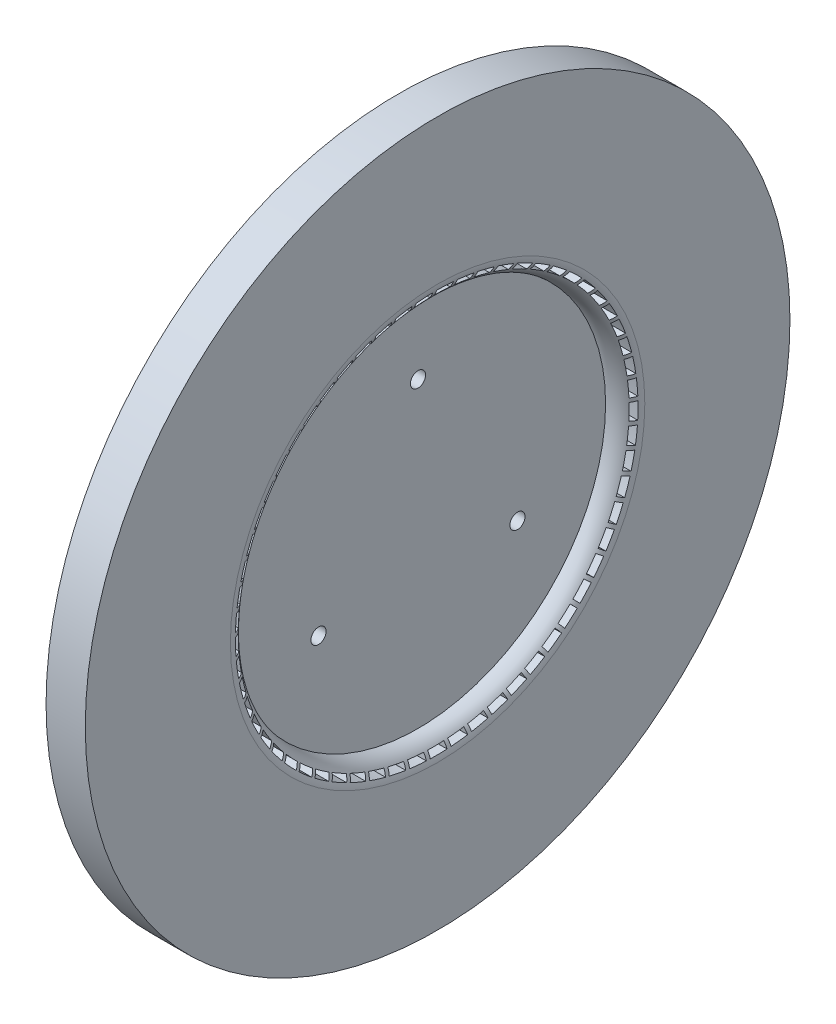
from build123d import *

# Parameters (mm, degrees)
SKETCH1_R                             = 89.825
SKETCH1_R_2                           = 47.825
FLANGE_DEPTH                          = 10
REGEN_SLOTS_DEPTH                     = 25
SKETCH3_R                             = 47.825
FACEPLATE_EXTRUSION_TO_MANIFOLD_DEPTH = 5
FACEPLATE_START                       = 5
SKETCH4_R                             = 47.825
FACEPLATE_EXTRUSION_TO_CHAMBER_DEPTH  = 5
REGEN_FILLET_R                        = 5
SKETCH5_R                             = 47.825
SKETCH5_R_2                           = 44.825
O_RING_SLOT_DEPTH                     = 6.5
SKETCH6_R                             = 1.931885
FUEL_ORIFICES_DEPTH                   = 128.914273062


with BuildPart() as part:
    # Sketch1 → Flange (new body)
    with BuildSketch(Plane(origin=(0, 0, 0), x_dir=(0, 0, -1), z_dir=(1, 0, 0))):
        Circle(SKETCH1_R)
        Circle(SKETCH1_R_2, mode=Mode.SUBTRACT)
    extrude(amount=FLANGE_DEPTH)

    # Sketch2 → Regen Slots (cut)
    with BuildSketch(Plane(origin=(10, 0, 0), x_dir=(0, 0, -1), z_dir=(1, 0, 0))):
        with BuildLine():
            ThreePointArc((-19.952615849, 45.655489766), (-18.042869594, 46.443357779), (-16.102104764, 47.15138224))
            Line((-16.102104764, 47.15138224), (-16.55836623, 48.580614784))
            ThreePointArc((-16.55836623, 48.580614784), (-18.57202224, 47.847002152), (-20.553296708, 47.029965123))
            Line((-20.553296708, 47.029965123), (-19.952615849, 45.655489766))
        make_face()
        with BuildLine():
            ThreePointArc((-15.152521521, 47.465057849), (-13.171887784, 48.052388049), (-11.168609468, 48.557108517))
            Line((-11.168609468, 48.557108517), (-11.475497576, 50.02567921))
            ThreePointArc((-11.475497576, 50.02567921), (-13.553911741, 49.503000934), (-15.608693769, 48.89401092))
            Line((-15.608693769, 48.89401092), (-15.152521521, 47.465057849))
        make_face()
        with BuildLine():
            ThreePointArc((-10.191806695, 48.77148451), (-8.161280686, 49.152051051), (-6.116724133, 49.448117364))
            Line((-6.116724133, 49.448117364), (-6.270985793, 50.940458991))
            ThreePointArc((-6.270985793, 50.940458991), (-8.392126406, 50.634255592), (-10.498634794, 50.239768038))
            Line((-10.498634794, 50.239768038), (-10.191806695, 48.77148451))
        make_face()
        with BuildLine():
            ThreePointArc((-5.123056182, 49.560921302), (-3.064161983, 49.730690085), (-1, 49.814963866))
            Line((-1, 49.814963866), (-1, 51.315257234))
            ThreePointArc((-1, 51.315257234), (-3.141382443, 51.228774545), (-5.277287678, 51.052971116))
            Line((-5.277287678, 51.052971116), (-5.123056182, 49.560921302))
        make_face()
        with BuildLine():
            Line((0, 51.325), (0, 49.825))
            ThreePointArc((0, 49.825), (2.065437599, 49.782171432), (4.127324381, 49.653759359))
            Line((4.127324381, 49.653759359), (4.281586042, 51.146100985))
            ThreePointArc((4.281586042, 51.146100985), (2.142660956, 51.280255743), (0, 51.325))
        make_face()
        with BuildLine():
            Line((5.277287678, 51.052971116), (5.123056182, 49.560921302))
            ThreePointArc((5.123056182, 49.560921302), (7.17314303, 49.305949378), (9.210898098, 48.966212649))
            Line((9.210898098, 48.966212649), (9.517786206, 50.434783342))
            ThreePointArc((9.517786206, 50.434783342), (7.403991615, 50.788153473), (5.277287678, 51.052971116))
        make_face()
        with BuildLine():
            Line((10.498634794, 50.239768038), (10.191806695, 48.77148451))
            ThreePointArc((10.191806695, 48.77148451), (12.204811359, 48.307071995), (14.196834003, 47.759611905))
            Line((14.196834003, 47.759611905), (14.653095469, 49.188844449))
            ThreePointArc((14.653095469, 49.188844449), (12.586838122, 49.757684141), (10.498634794, 50.239768038))
        make_face()
        with BuildLine():
            Line((15.608693769, 48.89401092), (15.152521521, 47.465057849))
            ThreePointArc((15.152521521, 47.465057849), (17.107105652, 46.79612763), (19.032279936, 46.046747393))
            Line((19.032279936, 46.046747393), (19.633078274, 47.421491567))
            ThreePointArc((19.633078274, 47.421491567), (17.636261013, 48.19977098), (15.608693769, 48.89401092))
        make_face()
        with BuildLine():
            Line((20.553296708, 47.029965123), (19.952615849, 45.655489766))
            ThreePointArc((19.952615849, 45.655489766), (21.828060369, 44.789132672), (23.665978967, 43.845775903))
            Line((23.665978967, 43.845775903), (24.404945566, 45.151459078))
            ThreePointArc((24.404945566, 45.151459078), (22.498735149, 46.130928255), (20.553296708, 47.029965123))
        make_face()
        with BuildLine():
            Line((25.280029588, 44.667389996), (24.541207486, 43.361962134))
            ThreePointArc((24.541207486, 43.361962134), (26.317632217, 42.307361765), (28.048812733, 41.180028282))
            Line((28.048812733, 41.180028282), (28.918114364, 42.402809891))
            ThreePointArc((28.918114364, 42.402809891), (27.122717097, 43.573086215), (25.280029588, 44.667389996))
        make_face()
        with BuildLine():
            Line((29.738787865, 41.831329423), (28.869656218, 40.608786917))
            ThreePointArc((28.869656218, 40.608786917), (30.528230615, 39.377122298), (32.134322107, 38.077762116))
            Line((32.134322107, 38.077762116), (33.124743955, 39.20468037))
            ThreePointArc((33.124743955, 39.20468037), (31.459191495, 40.553358621), (29.738787865, 41.831329423))
        make_face()
        with BuildLine():
            Line((33.882307593, 38.551846352), (32.892079412, 37.425148456))
            ThreePointArc((32.892079412, 37.425148456), (34.415222175, 36.02947554), (35.879199672, 34.571862199))
            Line((35.879199672, 34.571862199), (36.98024302, 35.590971484))
            ThreePointArc((36.98024302, 35.590971484), (35.462190638, 37.103755338), (33.882307593, 38.551846352))
        make_face()
        with BuildLine():
            Line((37.666666432, 34.863704119), (36.565838382, 33.844794111))
            ThreePointArc((36.565838382, 33.844794111), (37.937403818, 32.299907377), (39.243748795, 30.699491942))
            Line((39.243748795, 30.699491942), (40.443742309, 31.599989447))
            ThreePointArc((40.443742309, 31.599989447), (39.089281738, 33.260843017), (37.666666432, 34.863704119))
        make_face()
        with BuildLine():
            Line((41.051749236, 30.805997949), (39.851990369, 29.905676528))
            ThreePointArc((39.851990369, 29.905676528), (41.057439543, 28.227952161), (42.192304418, 26.501699434))
            Line((42.192304418, 26.501699434), (43.478527869, 27.27403966))
            ThreePointArc((43.478527869, 27.27403966), (42.302016727, 29.065357486), (41.051749236, 30.805997949))
        make_face()
        with BuildLine():
            Line((44.001673286, 26.421740537), (42.715701344, 25.649551335))
            ThreePointArc((42.715701344, 25.649551335), (43.742256194, 23.85677363), (44.693611118, 22.022982319))
            Line((44.693611118, 22.022982319), (46.052430217, 22.658978268))
            ThreePointArc((46.052430217, 22.658978268), (45.066339816, 24.561771935), (44.001673286, 26.421740537))
        make_face()
        with BuildLine():
            Line((46.485168653, 21.757406103), (45.126615258, 21.121534517))
            ThreePointArc((45.126615258, 21.121534517), (45.963394049, 19.232707363), (46.721154422, 17.310816112))
            Line((46.721154422, 17.310816112), (48.138165348, 17.803726069))
            ThreePointArc((48.138165348, 17.803726069), (47.352948491, 19.797825492), (46.485168653, 21.757406103))
        make_face()
        with BuildLine():
            Line((48.475909667, 16.862437752), (47.059175824, 16.369624179))
            ThreePointArc((47.059175824, 16.369624179), (47.697308492, 14.404769614), (48.253441866, 12.415150949))
            Line((48.253441866, 12.415150949), (49.713623951, 12.759749945))
            ThreePointArc((49.713623951, 12.759749945), (49.137604132, 14.824017173), (48.475909667, 16.862437752))
        make_face()
        with BuildLine():
            Line((49.95279398, 11.788723365), (48.49289742, 11.444191752))
            ThreePointArc((48.49289742, 11.444191752), (48.925619599, 9.424137723), (49.274230822, 7.387882096))
            Line((49.274230822, 7.387882096), (50.762105773, 7.580517297))
            ThreePointArc((50.762105773, 7.580517297), (50.401388946, 9.693070584), (49.95279398, 11.788723365))
        make_face()
        with BuildLine():
            Line((50.90016625, 6.590045578), (49.412582239, 6.397448045))
            ThreePointArc((49.412582239, 6.397448045), (49.635306968, 4.343607628), (49.772700674, 2.282299856))
            Line((49.772700674, 2.282299856), (51.272496646, 2.32092928))
            ThreePointArc((51.272496646, 2.32092928), (51.130906498, 4.459375036), (50.90016625, 6.590045578))
        make_face()
        with BuildLine():
            Line((51.307984095, 1.321511668), (49.808481394, 1.282889798))
            ThreePointArc((49.808481394, 1.282889798), (49.820870177, 0.64149807), (49.825, 0))
            ThreePointArc((49.825, 0), (49.804637718, -1.424319751), (49.743567516, -2.847475331))
            Line((49.743567516, -2.847475331), (51.239386299, -2.963261165))
            ThreePointArc((51.239386299, -2.963261165), (51.30359211, -1.482248835), (51.325, 0))
            ThreePointArc((51.325, 0), (51.320745847, 0.660810606), (51.307984095, 1.321511668))
        make_face()
        with BuildLine():
            Line((51.171924545, -3.961030594), (49.676398255, -3.8452674))
            ThreePointArc((49.676398255, -3.8452674), (49.474296322, -5.901239572), (49.187140168, -7.947066571))
            Line((49.187140168, -7.947066571), (50.66312571, -8.216040304))
            ThreePointArc((50.66312571, -8.216040304), (50.961952887, -6.093847961), (51.171924545, -3.961030594))
        make_face()
        with BuildLine():
            Line((50.493429865, -9.201584946), (49.017732937, -8.932663808))
            ThreePointArc((49.017732937, -8.932663808), (48.60530506, -10.956958749), (48.109316898, -12.962416928))
            Line((48.109316898, -12.962416928), (49.549823386, -13.381727372))
            ThreePointArc((49.549823386, -13.381727372), (50.065272674, -11.301508621), (50.493429865, -9.201584946))
        make_face()
        with BuildLine():
            Line((49.279692266, -14.344600209), (47.839467456, -13.925371756))
            ThreePointArc((47.839467456, -13.925371756), (47.221085473, -15.896531437), (46.521522901, -17.840362441))
            Line((46.521522901, -17.840362441), (47.911280607, -18.405564801))
            ThreePointArc((47.911280607, -18.405564801), (48.637888116, -16.389370478), (49.279692266, -14.344600209))
        make_face()
        with BuildLine():
            Line((47.543577671, -19.335559141), (46.154091718, -18.7704673))
            ThreePointArc((46.154091718, -18.7704673), (45.336310633, -20.667596938), (44.440589187, -22.529195674))
            Line((44.440589187, -22.529195674), (45.764866334, -23.234298664))
            ThreePointArc((45.764866334, -23.234298664), (46.694929844, -21.30350093), (47.543577671, -19.335559141))
        make_face()
        with BuildLine():
            Line((45.303489324, -24.121556336), (43.979471127, -23.416591221))
            ThreePointArc((43.979471127, -23.416591221), (42.970959622, -25.219580769), (41.888574173, -26.979213828))
            Line((41.888574173, -26.979213828), (43.133333094, -27.816743182))
            ThreePointArc((43.133333094, -27.816743182), (44.256993699, -25.991808973), (45.303489324, -24.121556336))
        make_face()
        with BuildLine():
            Line((42.583172721, -28.651859033), (41.3386572, -27.81449345))
            ThreePointArc((41.3386572, -27.81449345), (40.150105749, -29.50423077), (38.892529852, -31.143245604))
            Line((38.892529852, -31.143245604), (40.044575792, -32.104323301))
            ThreePointArc((40.044575792, -32.104323301), (41.349922412, -30.404597375), (42.583172721, -28.651859033))
        make_face()
        with BuildLine():
            Line((39.411463893, -32.878444897), (38.259643224, -31.917555129))
            ThreePointArc((38.259643224, -31.917555129), (36.903650767, -33.476128585), (35.484215039, -34.977151229))
            Line((35.484215039, -34.977151229), (36.531336025, -36.051589607))
            ThreePointArc((36.531336025, -36.051589607), (38.00453166, -34.495089481), (39.411463893, -32.878444897))
        make_face()
        with BuildLine():
            Line((35.821983743, -36.756511065), (34.775067511, -35.682282783))
            ThreePointArc((34.775067511, -35.682282783), (33.266007906, -37.09317111), (31.699758719, -38.44029035))
            Line((31.699758719, -38.44029035), (32.630855008, -39.616700095))
            ThreePointArc((32.630855008, -39.616700095), (34.256283418, -38.219925057), (35.821983743, -36.756511065))
        make_face()
        with BuildLine():
            Line((31.852781655, -40.244949073), (30.921867432, -39.068769363))
            ThreePointArc((30.921867432, -39.068769363), (29.275737086, -40.317016793), (27.579277071, -41.49595283))
            Line((27.579277071, -41.49595283), (28.384478811, -42.761863706))
            ThreePointArc((28.384478811, -42.761863706), (30.14491005, -41.53961992), (31.852781655, -40.244949073))
        make_face()
        with BuildLine():
            Line((27.545932157, -43.306780608), (26.740887866, -42.041117268))
            ThreePointArc((26.740887866, -42.041117268), (24.97513617, -43.113492068), (23.166448225, -44.111747887))
            Line((23.166448225, -44.111747887), (23.837220077, -45.453740924))
            ThreePointArc((23.837220077, -45.453740924), (25.713993136, -44.418984477), (27.545932157, -43.306780608))
        make_face()
        with BuildLine():
            Line((22.947088925, -45.909549495), (22.276448235, -44.567818872))
            ThreePointArc((22.276448235, -44.567818872), (20.409792597, -45.452953602), (18.508049264, -46.259947443))
            Line((18.508049264, -46.259947443), (19.03728088, -47.663797181))
            ThreePointArc((19.03728088, -47.663797181), (21.010501499, -46.827496749), (22.947088925, -45.909549495))
        make_face()
        with BuildLine():
            Line((18.105000842, -48.025665737), (17.575872712, -46.622090509))
            ThreePointArc((17.575872712, -46.622090509), (15.628100145, -47.31060252), (13.653460377, -47.917780048))
            Line((13.653460377, -47.917780048), (14.03554177, -49.36860533))
            ThreePointArc((14.03554177, -49.36860533), (16.084293318, -48.739625906), (18.105000842, -48.025665737))
        make_face()
        with BuildLine():
            Line((13.070995246, -49.632697975), (12.688988566, -48.182156388))
            ThreePointArc((12.688988566, -48.182156388), (10.680745944, -48.666747283), (8.654141414, -49.067672264))
            Line((8.654141414, -49.067672264), (8.885022426, -50.550093981))
            ThreePointArc((8.885022426, -50.550093981), (10.987587627, -50.135102903), (13.070995246, -49.632697975))
        make_face()
        with BuildLine():
            Line((7.898433849, -50.713611267), (7.667597984, -49.231479423))
            ThreePointArc((7.667597984, -49.231479423), (5.620173179, -49.507012417), (3.563086399, -49.697434947))
            Line((3.563086399, -49.697434947), (3.640319633, -51.195739061))
            ThreePointArc((3.640319633, -51.195739061), (5.774410774, -50.999135338), (7.898433849, -50.713611267))
        make_face()
        with BuildLine():
            Line((2.642147089, -51.256947663), (2.564928956, -49.758936529))
            ThreePointArc((2.564928956, -49.758936529), (0.50002518, -49.822490903), (-1.565738219, -49.800392457))
            Line((-1.565738219, -49.800392457), (-1.642971453, -51.29869657))
            ThreePointArc((-1.642971453, -51.29869657), (0.50002373, -51.322564251), (2.642147089, -51.256947663))
        make_face()
        with BuildLine():
            ThreePointArc((-2.564928956, -49.758936529), (-4.62542321, -49.609838592), (-6.677965622, -49.375453417))
            Line((-6.677965622, -49.375453417), (-6.908846633, -50.857875135))
            ThreePointArc((-6.908846633, -50.857875135), (-4.77966369, -51.101961215), (-2.642147089, -51.256947663))
            Line((-2.642147089, -51.256947663), (-2.564928956, -49.758936529))
        make_face()
        with BuildLine():
            ThreePointArc((-7.667597984, -49.231479423), (-9.701840963, -48.87130965), (-11.719404928, -48.427122288))
            Line((-11.719404928, -48.427122288), (-12.10148632, -49.87794757))
            ThreePointArc((-12.10148632, -49.87794757), (-10.008685486, -50.339664678), (-7.898433849, -50.713611267))
            Line((-7.898433849, -50.713611267), (-7.667597984, -49.231479423))
        make_face()
        with BuildLine():
            ThreePointArc((-12.688988566, -48.182156388), (-14.675416789, -47.614732668), (-16.636615626, -46.965451616))
            Line((-16.636615626, -46.965451616), (-17.165847242, -48.369301354))
            ThreePointArc((-17.165847242, -48.369301354), (-15.131612725, -49.043755172), (-13.070995246, -49.632697975))
            Line((-13.070995246, -49.632697975), (-12.688988566, -48.182156388))
        make_face()
        with BuildLine():
            ThreePointArc((-17.575872712, -46.622090509), (-19.493429546, -45.853427675), (-21.37747406, -45.005935473))
            Line((-21.37747406, -45.005935473), (-22.048245913, -46.34792851))
            ThreePointArc((-22.048245913, -46.34792851), (-20.094141106, -47.22796966), (-18.105000842, -48.025665737))
            Line((-18.105000842, -48.025665737), (-17.575872712, -46.622090509))
        make_face()
        with BuildLine():
            ThreePointArc((-22.276448235, -44.567818872), (-24.104807101, -43.606064941), (-25.891725951, -42.569345218))
            Line((-25.891725951, -42.569345218), (-26.696927691, -43.835256094))
            ThreePointArc((-26.696927691, -43.835256094), (-24.843666592, -44.911555921), (-22.947088925, -45.909549495))
            Line((-22.947088925, -45.909549495), (-22.276448235, -44.567818872))
        make_face()
        with BuildLine():
            ThreePointArc((-26.740887866, -42.041117268), (-28.460667703, -40.896467071), (-30.131519106, -39.681509313))
            Line((-30.131519106, -39.681509313), (-31.062615395, -40.857919059))
            ThreePointArc((-31.062615395, -40.857919059), (-29.329843032, -42.119068517), (-27.545932157, -43.306780608))
            Line((-27.545932157, -43.306780608), (-26.740887866, -42.041117268))
        make_face()
        with BuildLine():
            ThreePointArc((-30.921867432, -39.068769363), (-32.514838148, -37.753356476), (-34.051910662, -36.373039538))
            Line((-34.051910662, -36.373039538), (-35.099031649, -37.447477917))
            ThreePointArc((-35.099031649, -37.447477917), (-33.505115839, -38.880108508), (-31.852781655, -40.244949073))
            Line((-31.852781655, -40.244949073), (-30.921867432, -39.068769363))
        make_face()
        with BuildLine():
            ThreePointArc((-34.775067511, -35.682282783), (-36.224343219, -34.210050911), (-37.611343494, -32.679006496))
            Line((-37.611343494, -32.679006496), (-38.763389435, -33.640084193))
            ThreePointArc((-38.763389435, -33.640084193), (-37.325226083, -35.229009678), (-35.821983743, -36.756511065))
            Line((-35.821983743, -36.756511065), (-34.775067511, -35.682282783))
        make_face()
        with BuildLine():
            ThreePointArc((-38.259643224, -31.917555129), (-39.549861241, -30.304110295), (-40.772086729, -28.638567855))
            Line((-40.772086729, -28.638567855), (-42.01684565, -29.476097209))
            ThreePointArc((-42.01684565, -29.476097209), (-40.749679645, -31.20447458), (-39.411463893, -32.878444897))
            Line((-39.411463893, -32.878444897), (-38.259643224, -31.917555129))
        make_face()
        with BuildLine():
            ThreePointArc((-41.3386572, -27.81449345), (-42.456140895, -26.076938572), (-43.500635701, -24.29455327))
            Line((-43.500635701, -24.29455327), (-44.824912848, -24.999656261))
            ThreePointArc((-44.824912848, -24.999656261), (-43.742176466, -26.849164289), (-42.583172721, -28.651859033))
            Line((-42.583172721, -28.651859033), (-41.3386572, -27.81449345))
        make_face()
        with BuildLine():
            ThreePointArc((-43.979471127, -23.416591221), (-44.912374894, -21.573344812), (-45.768067113, -19.693010377))
            Line((-45.768067113, -19.693010377), (-47.157824819, -20.258212737))
            ThreePointArc((-47.157824819, -20.258212737), (-46.270995334, -22.209246178), (-45.303489324, -24.121556336))
            Line((-45.303489324, -24.121556336), (-43.979471127, -23.416591221))
        make_face()
        with BuildLine():
            ThreePointArc((-46.154091718, -18.7704673), (-46.892526546, -16.841068231), (-47.550345628, -14.882716675))
            Line((-47.550345628, -14.882716675), (-48.990852116, -15.302027119))
            ThreePointArc((-48.990852116, -15.302027119), (-48.309330141, -17.333904532), (-47.543577671, -19.335559141))
            Line((-47.543577671, -19.335559141), (-46.154091718, -18.7704673))
        make_face()
        with BuildLine():
            ThreePointArc((-47.839467456, -13.925371756), (-48.375605751, -11.930272137), (-48.828578651, -9.914662474))
            Line((-48.828578651, -9.914662474), (-50.304564193, -10.183636207))
            ThreePointArc((-50.304564193, -10.183636207), (-49.835574031, -12.274819185), (-49.279692266, -14.344600209))
            Line((-49.279692266, -14.344600209), (-47.839467456, -13.925371756))
        make_face()
        with BuildLine():
            ThreePointArc((-49.017732937, -8.932663808), (-49.3458915, -6.89301219), (-49.589216592, -4.841510384))
            Line((-49.589216592, -4.841510384), (-51.085035374, -4.957296218))
            ThreePointArc((-51.085035374, -4.957296218), (-50.833548438, -7.085617702), (-50.493429865, -9.201584946))
            Line((-50.493429865, -9.201584946), (-49.017732937, -8.932663808))
        make_face()
        with BuildLine():
            ThreePointArc((-49.676398255, -3.8452674), (-49.793098524, -1.7826846), (-49.824196501, 0.282962921))
            Line((-49.824196501, 0.282962921), (-51.323992473, 0.321592345))
            ThreePointArc((-51.323992473, 0.321592345), (-51.292674586, -1.821306909), (-51.171924545, -3.961030594))
            Line((-51.171924545, -3.961030594), (-49.676398255, -3.8452674))
        make_face()
        with BuildLine():
            ThreePointArc((-49.808481394, 1.282889798), (-49.712486316, 3.346539891), (-49.531027533, 5.404436748))
            Line((-49.531027533, 5.404436748), (-51.018902483, 5.597071949))
            ThreePointArc((-51.018902483, 5.597071949), (-51.208085623, 3.462310191), (-51.307984095, 1.321511668))
            Line((-51.307984095, 1.321511668), (-49.808481394, 1.282889798))
        make_face()
        with BuildLine():
            ThreePointArc((-49.412582239, 6.397448045), (-49.104909387, 8.440290227), (-48.71281735, 10.468622201))
            Line((-48.71281735, 10.468622201), (-50.172999435, 10.813221197))
            ThreePointArc((-50.172999435, 10.813221197), (-50.580678213, 8.709225942), (-50.90016625, 6.590045578))
            Line((-50.90016625, 6.590045578), (-49.412582239, 6.397448045))
        make_face()
        with BuildLine():
            ThreePointArc((-48.49289742, 11.444191752), (-47.976808202, 13.444571386), (-47.378239186, 15.421837655))
            Line((-47.378239186, 15.421837655), (-48.795250112, 15.914747611))
            ThreePointArc((-48.795250112, 15.914747611), (-49.417103031, 13.863821731), (-49.95279398, 11.788723365))
            Line((-49.95279398, 11.788723365), (-48.49289742, 11.444191752))
        make_face()
        with BuildLine():
            ThreePointArc((-47.059175824, 16.369624179), (-46.340140915, 18.306336744), (-45.5414399, 20.211577793))
            Line((-45.5414399, 20.211577793), (-46.900258998, 20.847573741))
            ThreePointArc((-46.900258998, 20.847573741), (-47.729694264, 18.871457561), (-48.475909667, 16.862437752))
            Line((-48.475909667, 16.862437752), (-47.059175824, 16.369624179))
        make_face()
        with BuildLine():
            ThreePointArc((-45.126615258, 21.121534517), (-44.212256606, 22.974050379), (-43.221890021, 24.787070178))
            Line((-43.221890021, 24.787070178), (-44.508113472, 25.559410404))
            ThreePointArc((-44.508113472, 25.559410404), (-45.536338864, 23.679051245), (-46.485168653, 21.757406103))
            Line((-46.485168653, 21.757406103), (-45.126615258, 21.121534517))
        make_face()
        with BuildLine():
            ThreePointArc((-39.851990369, 29.905676528), (-38.578029257, 31.53198826), (-37.23774635, 33.104091466))
            Line((-37.23774635, 33.104091466), (-38.338789698, 34.123200751))
            ThreePointArc((-38.338789698, 34.123200751), (-39.729905319, 32.492926128), (-41.051749236, 30.805997949))
            Line((-41.051749236, 30.805997949), (-39.851990369, 29.905676528))
        make_face()
        with BuildLine():
            ThreePointArc((-36.565838382, 33.844794111), (-35.131410429, 35.331496236), (-33.636585968, 36.757457874))
            Line((-33.636585968, 36.757457874), (-34.627007817, 37.884376129))
            ThreePointArc((-34.627007817, 37.884376129), (-36.178376815, 36.405778059), (-37.666666432, 34.863704119))
            Line((-37.666666432, 34.863704119), (-36.565838382, 33.844794111))
        make_face()
        with BuildLine():
            ThreePointArc((-32.892079412, 37.425148456), (-31.312389911, 38.756481562), (-29.678869408, 40.021186085))
            Line((-29.678869408, 40.021186085), (-30.548171039, 41.243967695))
            ThreePointArc((-30.548171039, 41.243967695), (-32.243348516, 39.932719685), (-33.882307593, 38.551846352))
            Line((-33.882307593, 38.551846352), (-32.892079412, 37.425148456))
        make_face()
        with BuildLine():
            ThreePointArc((-28.869656218, 40.608786917), (-27.16145027, 41.770638543), (-25.406549449, 42.860679767))
            Line((-25.406549449, 42.860679767), (-26.145516048, 44.166362943))
            ThreePointArc((-26.145516048, 44.166362943), (-27.966532702, 43.03636455), (-29.738787865, 41.831329423))
            Line((-29.738787865, 41.831329423), (-28.869656218, 40.608786917))
        make_face()
        with BuildLine():
            ThreePointArc((-24.541207486, 43.361962134), (-22.722592499, 44.342016363), (-20.864913745, 45.245839581))
            Line((-20.864913745, 45.245839581), (-21.465712083, 46.620583756))
            ThreePointArc((-21.465712083, 46.620583756), (-23.393264684, 45.683813243), (-25.280029588, 44.667389996))
            Line((-25.280029588, 44.667389996), (-24.541207486, 43.361962134))
        make_face()
        with BuildLine():
            ThreePointArc((-42.715701344, 25.649551335), (-41.615711378, 27.398233364), (-40.444177356, 29.099813453))
            Line((-40.444177356, 29.099813453), (-41.64417087, 30.000310957))
            ThreePointArc((-41.64417087, 30.000310957), (-42.860286943, 28.235641096), (-44.001673286, 26.421740537))
            Line((-44.001673286, 26.421740537), (-42.715701344, 25.649551335))
        make_face()
    extrude(amount=-REGEN_SLOTS_DEPTH, mode=Mode.SUBTRACT)



with BuildPart() as body_2:
    # Sketch3 → Faceplate Extrusion to Manifold (new body)
    with BuildSketch(Plane.ZY):
        with Locations(Location((0, 0, 0), (0, 0, 180))):
            Circle(SKETCH3_R)
    extrude(amount=-FACEPLATE_EXTRUSION_TO_MANIFOLD_DEPTH)


with BuildPart() as part_1:
    add(part.part)

    add(body_2.part)  # Faceplate Extrusion to Chamber merges body 2
    # Sketch4 → Faceplate Extrusion to Chamber (add)
    with BuildSketch(Plane.ZY.offset(FACEPLATE_START)):
        Circle(SKETCH4_R)
    extrude(amount=-FACEPLATE_EXTRUSION_TO_CHAMBER_DEPTH)

    # Regen Fillet
    # the kernel refuses this fillet: 5 mm, written as the material it takes off along each edge
    with BuildSketch(Plane(origin=(10, 0, 0), x_dir=(0, 0, -1), z_dir=(0, -1, 0))) as regen_fillet_piece_1:
        with BuildLine():
            CenterArc((47.825 + REGEN_FILLET_R, -REGEN_FILLET_R), REGEN_FILLET_R, 90, 90)
            Line((47.825 + REGEN_FILLET_R, 0), (47.825, 0))
            Line((47.825, 0), (47.825, -REGEN_FILLET_R))
        make_face()
    revolve(axis=Axis((10, 0, 0), (1, 0, 0)), mode=Mode.SUBTRACT)

    # Sketch5 → O-Ring Slot (cut)
    with BuildSketch(Plane.ZY.offset(5)):
        Circle(SKETCH5_R)
        Circle(SKETCH5_R_2, mode=Mode.SUBTRACT)
    extrude(amount=-O_RING_SLOT_DEPTH, mode=Mode.SUBTRACT)

    # Sketch6 → Fuel Orifices (cut, through all)
    with BuildSketch(Plane.ZY.offset(5)):
        with Locations((0, 29.2826)):
            Circle(SKETCH6_R)
        with Locations((25.359475489, -14.6413)):
            Circle(SKETCH6_R)
        with Locations((-25.359475489, -14.6413)):
            Circle(SKETCH6_R)
    extrude(amount=-FUEL_ORIFICES_DEPTH, mode=Mode.SUBTRACT)


solid = part_1.part
